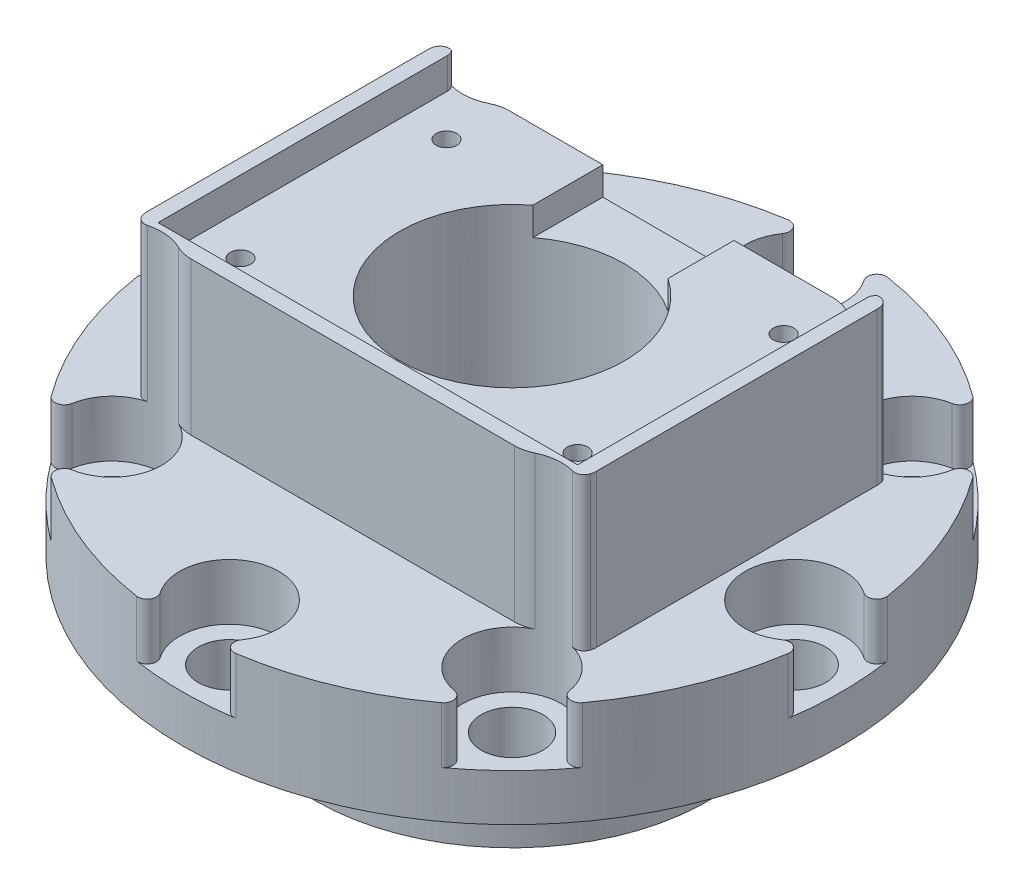
from build123d import *
from build123d.topology import SkipClean

# Parameters (mm, degrees)
SKETCH2_R           = 17.6
SKETCH2_R_2         = 6
SKETCH2_R_3         = 1.65
BOSS_EXTRUDE1_DEPTH = 2.5
SKETCH3_R           = 10.49
SKETCH3_R_2         = 8.49
BOSS_EXTRUDE2_DEPTH = 6.1
BOSS_EXTRUDE3_START = 9.5
SKETCH5_R           = 6
BOSS_EXTRUDE3_DEPTH = 9.5
BOSS_EXTRUDE4_DEPTH = 1.65
SKETCH7_R           = 2.65
CUT_EXTRUDE1_DEPTH  = 28.273476126
SKETCH8_R           = 6
BOSS_EXTRUDE5_DEPTH = 3
FILLET2_R           = 0.5
FILLET3_R           = 0.5
FILLET4_R           = 2
CHAMFER1_SIZE       = 0.5
SKETCH9_R           = 0.55
CUT_EXTRUDE2_DEPTH  = 5
SKETCH10_R          = 8.49
CUT_EXTRUDE4_DEPTH  = 0.3
CUT_EXTRUDE5_DEPTH  = 1.5


with BuildPart() as part:
    # Sketch2 → Boss-Extrude1 (new body)
    with BuildSketch(Plane(origin=(0, 6.1, 0), x_dir=(1, 0, 0), z_dir=(0, 1, 0))):
        with Locations(Location((0, 0, 0), (0, 0, 270))):
            Circle(SKETCH2_R)
        with Locations(Location((0, 0, 0), (0, 0, 270))):
            Circle(SKETCH2_R_2, mode=Mode.SUBTRACT)
        with Locations(Location((0, -15.1, 0), (0, 0, 270))):
            Circle(SKETCH2_R_3, mode=Mode.SUBTRACT)
        with Locations(Location((-10.677312396, -10.677312396, 0), (0, 0, 270))):
            Circle(SKETCH2_R_3, mode=Mode.SUBTRACT)
        with Locations(Location((-15.1, 0, 0), (0, 0, 270))):
            Circle(SKETCH2_R_3, mode=Mode.SUBTRACT)
        with Locations(Location((-10.677312396, 10.677312396, 0), (0, 0, 270))):
            Circle(SKETCH2_R_3, mode=Mode.SUBTRACT)
        with Locations(Location((0, 15.1, 0), (0, 0, 270))):
            Circle(SKETCH2_R_3, mode=Mode.SUBTRACT)
        with Locations(Location((10.677312396, 10.677312396, 0), (0, 0, 270))):
            Circle(SKETCH2_R_3, mode=Mode.SUBTRACT)
        with Locations(Location((15.1, 0, 0), (0, 0, 270))):
            Circle(SKETCH2_R_3, mode=Mode.SUBTRACT)
        with Locations(Location((10.677312396, -10.677312396, 0), (0, 0, 270))):
            Circle(SKETCH2_R_3, mode=Mode.SUBTRACT)
    extrude(amount=BOSS_EXTRUDE1_DEPTH)

    # Sketch3 → Boss-Extrude2 (add)
    with BuildSketch(Plane(origin=(0, 0, 0), x_dir=(1, 0, 0), z_dir=(0, 1, 0))):
        with Locations(Location((0, 0, 0), (0, 0, 270))):
            Circle(SKETCH3_R)
        with Locations(Location((0, 0, 0), (0, 0, 270))):
            Circle(SKETCH3_R_2, mode=Mode.SUBTRACT)
    extrude(amount=BOSS_EXTRUDE2_DEPTH)

    # Sketch5 → Boss-Extrude3 (add)
    with BuildSketch(Plane(origin=(0, 18.1, 0), x_dir=(-1, 0, 0), z_dir=(0, -1, 0)).offset(BOSS_EXTRUDE3_START)):
        with BuildLine():
            Line((-12, 7.5), (-12, -7.5))
            ThreePointArc((-12, -7.5), (-11.707106781, -8.207106781), (-11, -8.5))
            Line((-11, -8.5), (11, -8.5))
            ThreePointArc((11, -8.5), (11.707106781, -8.207106781), (12, -7.5))
            Line((12, -7.5), (12, 7.5))
            ThreePointArc((12, 7.5), (11.707106781, 8.207106781), (11, 8.5))
            Line((11, 8.5), (-11, 8.5))
            ThreePointArc((-11, 8.5), (-11.707106781, 8.207106781), (-12, 7.5))
        make_face()
        with Locations(Location((0, 0, 0), (0, 0, 180))):
            Circle(SKETCH5_R, mode=Mode.SUBTRACT)
    extrude(amount=-BOSS_EXTRUDE3_DEPTH)

    # Sketch6 → Boss-Extrude4 (add)
    with BuildSketch(Plane(origin=(0, 18.1, 0), x_dir=(1, 0, 0), z_dir=(0, 1, 0))):
        with BuildLine():
            Line((-12, 7.5), (-12, -7.5))
            ThreePointArc((-12, -7.5), (-11.707106781, -8.207106781), (-11, -8.5))
            Line((-11, -8.5), (11, -8.5))
            ThreePointArc((11, -8.5), (11.707106781, -8.207106781), (12, -7.5))
            Line((12, -7.5), (12, 7.5))
            ThreePointArc((12, 7.5), (11.774596669, 8.132455532), (11.2, 8.479795897))
            Line((11.2, 8.479795897), (11.2, -7.7))
            Line((11.2, -7.7), (-11.2, -7.7))
            Line((-11.2, -7.7), (-11.2, 8.479795897))
            ThreePointArc((-11.2, 8.479795897), (-11.774596669, 8.132455532), (-12, 7.5))
        make_face()
    extrude(amount=BOSS_EXTRUDE4_DEPTH)

    # Sketch7 → Cut-Extrude1 (cut, through all)
    with BuildSketch(Plane(origin=(0, 8.6, 0), x_dir=(1, 0, 0), z_dir=(0, 1, 0))):
        with Locations((10.677312396, 10.677312396)):
            Circle(SKETCH7_R)
        with Locations((-10.677312396, 10.677312396)):
            Circle(SKETCH7_R)
        with Locations((-10.677312396, -10.677312396)):
            Circle(SKETCH7_R)
        with Locations((10.677312396, -10.677312396)):
            Circle(SKETCH7_R)
    extrude(amount=CUT_EXTRUDE1_DEPTH, mode=Mode.SUBTRACT)

    # Sketch8 → Boss-Extrude5 (add)
    with SkipClean():  # the faces are left unmerged after this step: merging them gives an invalid solid
        with BuildSketch(Plane(origin=(0, 8.6, 0), x_dir=(1, 0, 0), z_dir=(0, 1, 0))):
            with BuildLine():
                ThreePointArc((0.948547859, -17.57442053), (6.73522841, -16.260279772), (11.756267308, -13.097716556))
                ThreePointArc((11.756267308, -13.097716556), (8.803479426, -8.803479426), (13.097716556, -11.756267308))
                ThreePointArc((13.097716556, -11.756267308), (16.260279772, -6.73522841), (17.57442053, -0.948547859))
                ThreePointArc((17.57442053, -0.948547859), (12.45, 0), (17.57442053, 0.948547859))
                ThreePointArc((17.57442053, 0.948547859), (16.260279772, 6.73522841), (13.097716556, 11.756267308))
                ThreePointArc((13.097716556, 11.756267308), (8.803479426, 8.803479426), (11.756267308, 13.097716556))
                ThreePointArc((11.756267308, 13.097716556), (6.73522841, 16.260279772), (0.948547859, 17.57442053))
                ThreePointArc((0.948547859, 17.57442053), (0, 12.45), (-0.948547859, 17.57442053))
                ThreePointArc((-0.948547859, 17.57442053), (-6.73522841, 16.260279772), (-11.756267308, 13.097716556))
                ThreePointArc((-11.756267308, 13.097716556), (-8.803479426, 8.803479426), (-13.097716556, 11.756267308))
                ThreePointArc((-13.097716556, 11.756267308), (-16.260279772, 6.73522841), (-17.57442053, 0.948547859))
                ThreePointArc((-17.57442053, 0.948547859), (-12.45, 0), (-17.57442053, -0.948547859))
                ThreePointArc((-17.57442053, -0.948547859), (-16.260279772, -6.73522841), (-13.097716556, -11.756267308))
                ThreePointArc((-13.097716556, -11.756267308), (-8.803479426, -8.803479426), (-11.756267308, -13.097716556))
                ThreePointArc((-11.756267308, -13.097716556), (-6.73522841, -16.260279772), (-0.948547859, -17.57442053))
                ThreePointArc((-0.948547859, -17.57442053), (0, -12.45), (0.948547859, -17.57442053))
            make_face()
            Circle(SKETCH8_R, mode=Mode.SUBTRACT)
        extrude(amount=BOSS_EXTRUDE5_DEPTH)

    # Fillet2
    # the kernel refuses this fillet: 0.5 mm, written as the material it takes off along each edge
    with BuildSketch(Plane(origin=(-11.686597151, 21.100589596, 8.227038068), x_dir=(0.947787501737023, 0, -0.3189025737605338), z_dir=(0, -1, 0)), Plane(origin=(11.686597151, 21.100589596, -8.227038068), x_dir=(-0.9477875017370256, 0, 0.3189025737605259), z_dir=(0, -1, 0))) as fillet2_piece_1:
        with BuildLine():
            CenterArc((0.383431843, -0.498906206), FILLET2_R, 93.790527606, 89.509954117)
            ThreePointArc((-0.115738823, -0.527692416), (-0.094179071, -0.255882407), (0, 0))
            ThreePointArc((0, 0), (0.175188687, -0.00579711), (0.350377374, 0))
        make_face()
    extrude(amount=9.500589596, mode=Mode.SUBTRACT)
    with BuildSketch(Plane(origin=(11.686597151, 21.100589596, 8.227038068), x_dir=(0.5145498683464933, 0, -0.8574604556389797), z_dir=(0, -1, 0)), Plane(origin=(-11.686597151, 21.100589596, -8.227038068), x_dir=(-0.5145498683463678, 0, 0.8574604556390548), z_dir=(0, -1, 0))) as fillet2_piece_2:
        with BuildLine():
            CenterArc((0.405176879, -0.481413624), FILLET2_R, 74.328716152, 89.509954117)
            ThreePointArc((-0.075064004, -0.342242165), (-0.031869492, -0.172363041), (0, 0))
            ThreePointArc((0, 0), (0.270117919, 0.037172752), (0.540235838, 0))
        make_face()
    extrude(amount=9.500589596, mode=Mode.SUBTRACT)
    with BuildSketch(Plane(origin=(11.756267308, 8.6, 13.097716556), x_dir=(-0.7759095356901404, 0, 0.6308441902919537), z_dir=(0, 1, 0)), Plane(origin=(13.097716556, 8.6, -11.756267308), x_dir=(0.6308441902919549, 0, 0.7759095356901394), z_dir=(0, 1, 0)), Plane(origin=(-11.756267308, 8.6, -13.097716556), x_dir=(0.775909535690134, 0, -0.6308441902919616), z_dir=(0, 1, 0)), Plane(origin=(-13.097716556, 8.6, 11.756267308), x_dir=(-0.630844190291963, 0, -0.7759095356901329), z_dir=(0, 1, 0)), Plane(origin=(17.57442053, 8.6, 0.948547859), x_dir=(-0.1025766894462237, 0, 0.9947250991013814), z_dir=(0, 1, 0)), Plane(origin=(0.948547859, 8.6, -17.57442053), x_dir=(0.9947250991013814, 0, 0.10257668944622358), z_dir=(0, 1, 0)), Plane(origin=(-17.57442053, 8.6, -0.948547859), x_dir=(0.1025766894462172, 0, -0.9947250991013821), z_dir=(0, 1, 0)), Plane(origin=(-0.948547859, 8.6, 17.57442053), x_dir=(-0.9947250991013822, 0, -0.10257668944621537), z_dir=(0, 1, 0))) as fillet2_piece_3:
        with BuildLine():
            CenterArc((1.693954461, -0.499403867), FILLET2_R, 87.201872274, 133.621879811)
            ThreePointArc((1.315592404, -0.826271047), (0.71970544, -0.314563362), (0, 0))
            ThreePointArc((0, 0), (0.859181513, 0.020983898), (1.718363027, 0))
        make_face()
    extrude(amount=7.295907567, mode=Mode.SUBTRACT)
    with BuildSketch(Plane(origin=(13.097716556, 8.6, 11.756267308), x_dir=(0.6308441902919746, 0, -0.7759095356901236), z_dir=(0, 1, 0)), Plane(origin=(17.57442053, 8.6, -0.948547859), x_dir=(-0.1025766894462046, 0, -0.9947250991013833), z_dir=(0, 1, 0)), Plane(origin=(11.756267308, 8.6, -13.097716556), x_dir=(-0.7759095356901274, 0, -0.6308441902919697), z_dir=(0, 1, 0)), Plane(origin=(-0.948547859, 8.6, -17.57442053), x_dir=(-0.9947250991013827, 0, 0.10257668944621066), z_dir=(0, 1, 0)), Plane(origin=(-13.097716556, 8.6, -11.756267308), x_dir=(-0.6308441902919705, 0, 0.7759095356901267), z_dir=(0, 1, 0)), Plane(origin=(-17.57442053, 8.6, 0.948547859), x_dir=(0.10257668944620901, 0, 0.9947250991013828), z_dir=(0, 1, 0)), Plane(origin=(-11.756267308, 8.6, 13.097716556), x_dir=(0.7759095356901295, 0, 0.630844190291967), z_dir=(0, 1, 0)), Plane(origin=(0.948547859, 8.6, 17.57442053), x_dir=(0.9947250991013818, 0, -0.10257668944621866), z_dir=(0, 1, 0))) as fillet2_piece_4:
        with BuildLine():
            CenterArc((1.693954461, 0.499403867), FILLET2_R, 139.176247915, 133.621879811)
            ThreePointArc((1.315592404, 0.826271047), (0.71970544, 0.314563362), (0, 0))
            ThreePointArc((0, 0), (0.859181513, -0.020983898), (1.718363027, 0))
        make_face()
    extrude(amount=7.295907567, mode=Mode.SUBTRACT)

    # Fillet3
    # the kernel refuses this fillet: 0.5 mm, written as the material it takes off along each edge
    with BuildSketch(Plane(origin=(-11.2, 20.563775383, -8.079371352), x_dir=(0, 0, 1), z_dir=(0, -1, 0))) as fillet3_piece_1:
        with BuildLine():
            CenterArc((0.325510153, 0.5), FILLET3_R, 223.707123391, 46.292876609)
            Line((-0.03593047, 0.154513855), (-0.043159282, 0.147604132))
            ThreePointArc((-0.043159282, 0.147604132), (-0.026548893, 0.075260894), (-0.009803551, -0.001972406))
            Line((-0.009803551, -0.001972406), (0, -0.01))
            Line((0, -0.01), (0.325510153, -0.01))
            Line((0.325510153, -0.01), (0.325510153, 0))
        make_face()
    extrude(amount=2.463775383, mode=Mode.SUBTRACT)
    with BuildSketch(Plane(origin=(11.2, 20.563775383, -8.079371352), x_dir=(0.9740121783889754, 0, -0.2264956431147472), z_dir=(0, -1, 0))) as fillet3_piece_2:
        with BuildLine():
            CenterArc((0.413279458, 0.430298675), FILLET3_R, 193.090842954, 46.292876609)
            Line((-0.073726631, 0.317050853), (-0.083466753, 0.314785897))
            Line((-0.083466753, 0.314785897), (-0.009740122, -0.002264956))
            Line((-0.009740122, -0.002264956), (0.000299314, -0.00999552))
            ThreePointArc((0.000299314, -0.00999552), (0.079318236, -0.008812681), (0.153543612, -0.008605973))
            Line((0.153543612, -0.008605973), (0.158636471, 0))
        make_face()
    extrude(amount=2.463775383, mode=Mode.SUBTRACT)

    # Fillet4
    fillet4_edges = [part.edges().sort_by_distance(p)[0] for p in [
        (9.166746035, 15.675, 8.5),
        (-9.166746035, 14.85, -8.5),
        (-9.166746035, 15.675, 8.5),
        (9.166746035, 14.85, -8.5),
    ]]
    fillet(fillet4_edges, radius=FILLET4_R)

    # Chamfer1
    chamfer1_edges = [part.edges().sort_by_distance(p)[0] for p in [
        (0, 0, -8.49),
    ]]
    chamfer(chamfer1_edges, length=CHAMFER1_SIZE)

    # Sketch9 → Cut-Extrude2 (cut)
    with BuildSketch(Plane(origin=(0, 18.1, 0), x_dir=(1, 0, 0), z_dir=(0, 1, 0))):
        with Locations(Location((9, -5.5, 0), (0, 0, 180))):
            Circle(SKETCH9_R)
        with Locations(Location((-9, -5.5, 0), (0, 0, 180))):
            Circle(SKETCH9_R)
        with Locations(Location((-9, 5.5, 0), (0, 0, 180))):
            Circle(SKETCH9_R)
        with Locations(Location((9, 5.5, 0), (0, 0, 180))):
            Circle(SKETCH9_R)
    extrude(amount=-CUT_EXTRUDE2_DEPTH, mode=Mode.SUBTRACT)

    # Sketch10 → Cut-Extrude4 (cut)
    with BuildSketch(Plane.XZ.offset(-6.1)):
        with Locations(Location((0, 0, 0), (0, 0, 270))):
            Circle(SKETCH10_R)
    extrude(amount=-CUT_EXTRUDE4_DEPTH, mode=Mode.SUBTRACT)

    # Sketch11 → Cut-Extrude5 (cut)
    with BuildSketch(Plane(origin=(0, 18.1, 0), x_dir=(1, 0, 0), z_dir=(0, 1, 0))):
        Polygon((-5.2, 9), (-5.2, 11.5), (3.35, 11.5), (3.35, 4.5), (-3.65, 4.5), (-3.65, 9), align=None)
    extrude(amount=-CUT_EXTRUDE5_DEPTH, mode=Mode.SUBTRACT)


solid = part.part
